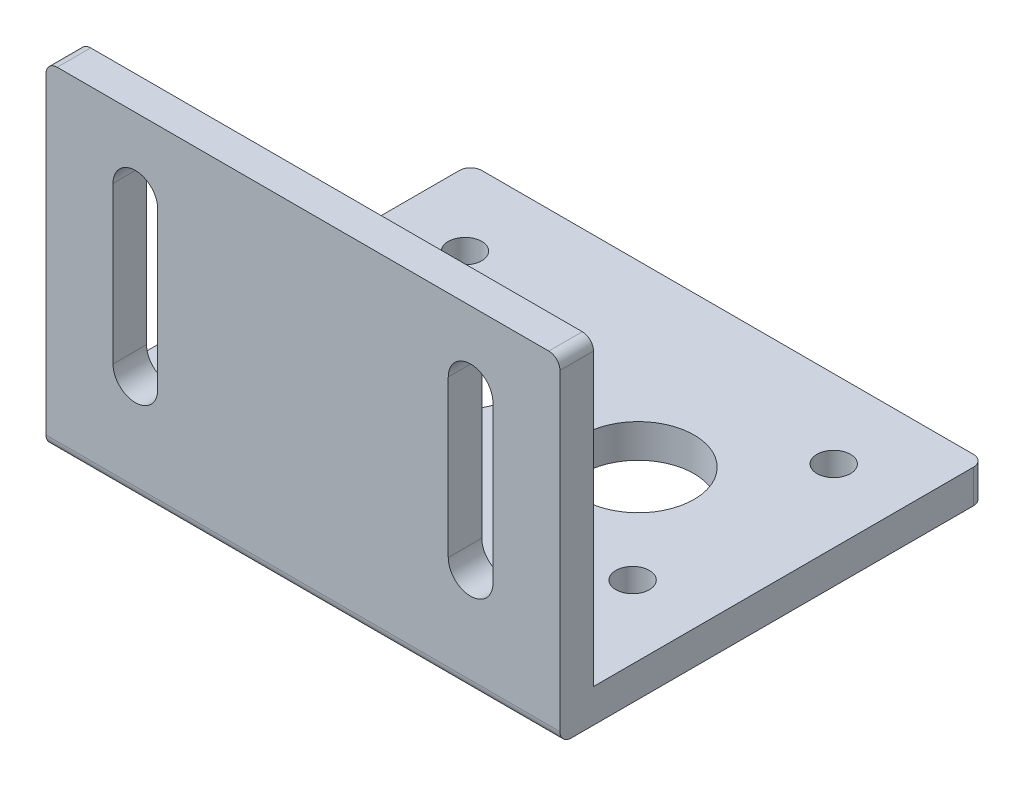
from build123d import *

# Parameters (mm, degrees)
SKETCH2_R           = 5
SKETCH2_R_2         = 1.5
BOSS_EXTRUDE1_DEPTH = 3
SKETCH3_W           = 46
SKETCH3_H           = 3
BOSS_EXTRUDE2_DEPTH = 27
CUT_EXTRUDE1_DEPTH  = 52.51698749
FILLET1_R           = 1
FILLET2_R           = 1


with BuildPart() as part:
    # Sketch2 → Boss-Extrude1 (new body)
    with BuildSketch(Plane(origin=(0, 0, 0), x_dir=(1, 0, 0), z_dir=(0, 1, 0))):
        with BuildLine():
            Line((-22, 19), (22, 19))
            ThreePointArc((22, 19), (22.707106781, 18.707106781), (23, 18))
            Line((23, 18), (23, -19))
            Line((23, -19), (-23, -19))
            Line((-23, -19), (-23, 18))
            ThreePointArc((-23, 18), (-22.707106781, 18.707106781), (-22, 19))
        make_face()
        with Locations((8, 3)):
            Circle(SKETCH2_R, mode=Mode.SUBTRACT)
        with Locations((-8, 3)):
            Circle(SKETCH2_R, mode=Mode.SUBTRACT)
        with Locations((-16.5, 12)):
            Circle(SKETCH2_R_2, mode=Mode.SUBTRACT)
        with Locations((-16.5, -6)):
            Circle(SKETCH2_R_2, mode=Mode.SUBTRACT)
        with Locations((16.5, -6)):
            Circle(SKETCH2_R_2, mode=Mode.SUBTRACT)
        with Locations((16.5, 12)):
            Circle(SKETCH2_R_2, mode=Mode.SUBTRACT)
    extrude(amount=BOSS_EXTRUDE1_DEPTH)

    # Sketch3 → Boss-Extrude2 (add)
    with BuildSketch(Plane(origin=(0, 3, 0), x_dir=(1, 0, 0), z_dir=(0, 1, 0))):
        with Locations((0, -17.5)):
            Rectangle(SKETCH3_W, SKETCH3_H)
    extrude(amount=BOSS_EXTRUDE2_DEPTH)

    # Sketch4 → Cut-Extrude1 (cut, through all)
    with BuildSketch(Plane(origin=(0, 0, 16), x_dir=(-1, 0, 0), z_dir=(0, 0, -1))):
        with BuildLine():
            Line((-17, 23.5), (-17, 9.5))
            ThreePointArc((-17, 9.5), (-15, 7.5), (-13, 9.5))
            Line((-13, 9.5), (-13, 23.5))
            ThreePointArc((-13, 23.5), (-15, 25.5), (-17, 23.5))
        make_face()
        with BuildLine():
            Line((13, 23.5), (13, 9.5))
            ThreePointArc((13, 9.5), (15, 7.5), (17, 9.5))
            Line((17, 9.5), (17, 23.5))
            ThreePointArc((17, 23.5), (15, 25.5), (13, 23.5))
        make_face()
    extrude(amount=-CUT_EXTRUDE1_DEPTH, mode=Mode.SUBTRACT)

    # Fillet1
    fillet1_edges = [part.edges().sort_by_distance(p)[0] for p in [
        (-23, 30, 17.5),
        (23, 30, 17.5),
    ]]
    fillet(fillet1_edges, radius=FILLET1_R)

    # Fillet2
    fillet2_edges = [part.edges().sort_by_distance(p)[0] for p in [
        (0, 0, 19),
    ]]
    fillet(fillet2_edges, radius=FILLET2_R)


solid = part.part
